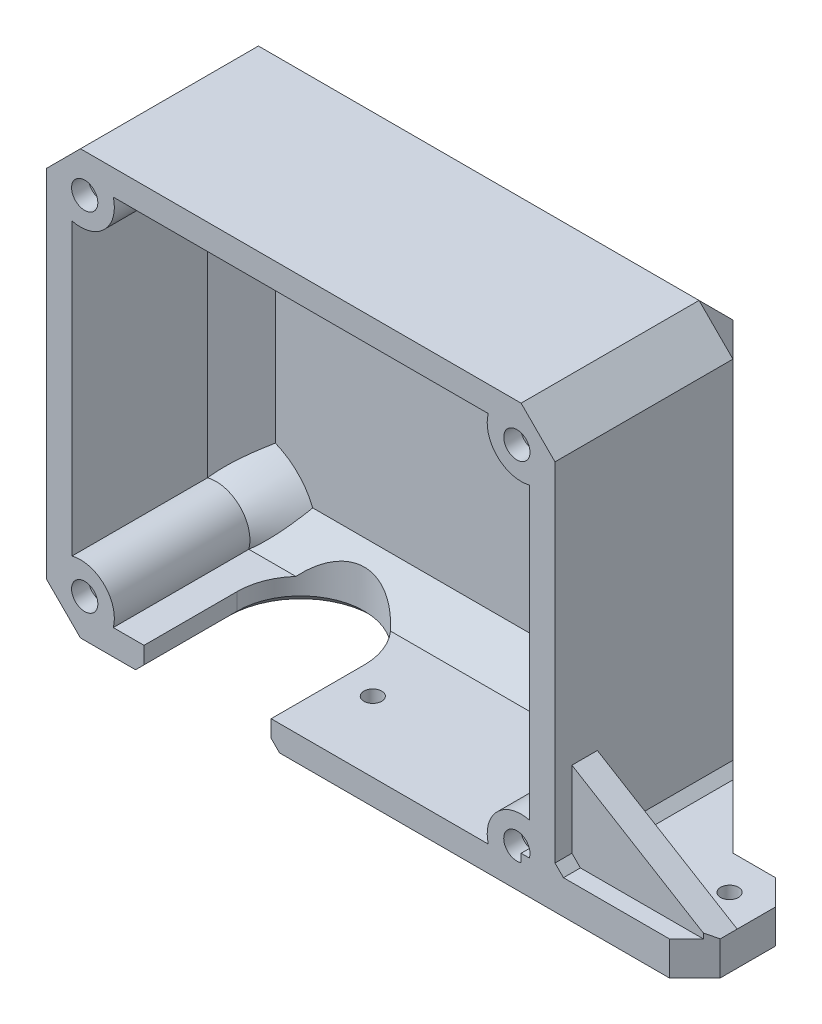
from build123d import *

# Parameters (mm, degrees)
BOSS_EXTRUDE1_DEPTH = 5
BOSS_EXTRUDE2_DEPTH = 20
CHAMFER1_SIZE       = 4
CHAMFER2_SIZE       = 4
CUT_EXTRUDE1_REACH  = 84.006
SKETCH3_R           = 7.5
SKETCH5_R           = 1.550000000000001
SKETCH5_R_2         = 1.5500000000000018
SKETCH5_R_3         = 1.5500000000000012
SKETCH5_R_4         = 1.5500000000000003
CUT_EXTRUDE2_DEPTH  = 2
CHAMFER3_SIZE       = 1
BOSS_EXTRUDE3_DEPTH = 4
CUT_EXTRUDE3_REACH  = 81.126
CUT_EXTRUDE5_REACH  = 96.748
SKETCH10_R          = 1.050000000000002
SKETCH10_R_2        = 1.0499999999999956
BOSS_EXTRUDE5_DEPTH = 3
CHAMFER6_SIZE       = 1
CHAMFER7_SIZE       = 3


with BuildPart() as part:
    # Sketch1 → Boss-Extrude1 (new body)
    with BuildSketch(Plane.XY):
        Polygon((0, 0), (3.28e-15, 50), (60, 50), (60, -1.4e-16), align=None)
    extrude(amount=BOSS_EXTRUDE1_DEPTH)

    # Sketch2 → Boss-Extrude2 (add)
    with BuildSketch(Plane.XY.offset(5)):
        with BuildLine():
            Line((7.872983346207448, 47), (52.127016653792545, 47))
            ThreePointArc((52.12701665379256, 46.99999999999996), (53.55051025721673, 49.16227766016832), (55.99999999999984, 50.00000000000001))
            Line((55.99999999999984, 50), (3.9999999999998224, 50))
            ThreePointArc((3.999999999999821, 50), (6.449489742783131, 49.16227766016842), (7.872983346207436, 46.99999999999996))
        make_face()
        with BuildLine():
            ThreePointArc((0, 46), (1.1715728752537458, 48.82842712474613), (3.999999999999821, 50))
            Line((3.9999999999998224, 50), (0, 50))
            Line((3.28e-15, 50), (3.02e-15, 46))
        make_face()
        with BuildLine():
            ThreePointArc((8.000000000000007, 46), (7.968118785068677, 46.50401716993089), (7.872983346207436, 46.99999999999996))
            Line((7.872983346207448, 47), (3.000000000000007, 47))
            Line((3.0000000000000036, 47), (3.000000000000003, 42.12701665379265))
            ThreePointArc((2.999999999999857, 42.127016653792616), (6.4494897427831255, 42.83772233983157), (8.000000000000007, 46))
        make_face()
        with BuildLine():
            Line((3.000000000000007, 47), (7.872983346207448, 47))
            ThreePointArc((7.872983346207436, 46.99999999999996), (6.449489742783131, 49.16227766016842), (3.999999999999821, 50))
            ThreePointArc((3.999999999999821, 50), (1.1715728752537458, 48.82842712474613), (0, 46))
            ThreePointArc((0, 46), (0.8377223398315752, 43.55051025721688), (2.999999999999857, 42.127016653792616))
            Line((3.000000000000003, 42.12701665379265), (3.0000000000000036, 47))
        make_face()
        with BuildLine():
            ThreePointArc((-1.78e-15, 3.9999999936735127), (0.8377223378945806, 6.449489740282477), (3.0000000000001434, 7.8729833462074605))
            Line((3.000000000000001, 7.872983346207491), (3.000000000000003, 42.12701665379265))
            ThreePointArc((2.999999999999857, 42.127016653792616), (0.8377223398315752, 43.55051025721688), (0, 46))
            Line((3.02e-15, 46), (2.6e-16, 3.999999993673512))
        make_face()
        with BuildLine():
            ThreePointArc((8.000000000000007, 46), (7.968118785068677, 46.50401716993089), (7.872983346207436, 46.99999999999996))
            Line((7.872983346207448, 47), (3.000000000000007, 47))
            Line((3.0000000000000036, 47), (3.000000000000003, 42.12701665379265))
            ThreePointArc((2.999999999999857, 42.127016653792616), (6.4494897427831255, 42.83772233983157), (8.000000000000007, 46))
        make_face()
        with BuildLine():
            Line((3.000000000000007, 47), (7.872983346207448, 47))
            ThreePointArc((7.872983346207436, 46.99999999999996), (6.449489742783131, 49.16227766016842), (3.999999999999821, 50))
            ThreePointArc((3.999999999999821, 50), (1.1715728752537458, 48.82842712474613), (0, 46))
            ThreePointArc((0, 46), (0.8377223398315752, 43.55051025721688), (2.999999999999857, 42.127016653792616))
            Line((3.000000000000003, 42.12701665379265), (3.0000000000000036, 47))
        make_face()
        with BuildLine():
            ThreePointArc((3.999999999999755, 8.9e-16), (6.449489742783102, 0.8377223398315614), (7.872983346207432, 3.0000000000000497))
            Line((7.8729833462074446, 3), (3.0000000000000004, 3))
            Line((3.0000000000000004, 3), (3.000000000000001, 7.872983346207491))
            ThreePointArc((3.0000000000001434, 7.8729833462074605), (0.8377223378945806, 6.449489740282477), (-1.78e-15, 3.9999999936735127))
            ThreePointArc((-1.78e-15, 3.9999999936735127), (1.1715728774904743, 1.1715728730171464), (3.999999999999755, 8.9e-16))
        make_face()
        with BuildLine():
            Line((3.0000000000000004, 3), (7.8729833462074446, 3))
            ThreePointArc((7.872983346207432, 3.0000000000000497), (7.968118785068674, 3.4959828300691127), (8.000000000000004, 4.000000000000003))
            ThreePointArc((8.000000000000004, 4.0000000000000036), (6.449489742783239, 7.16227766016834), (3.0000000000001434, 7.8729833462074605))
            Line((3.000000000000001, 7.872983346207491), (3.0000000000000004, 3))
        make_face()
        with BuildLine():
            Line((0, 0), (3.999999999999755, -1e-17))
            ThreePointArc((3.999999999999755, 8.9e-16), (1.1715728774904743, 1.1715728730171464), (-1.78e-15, 3.9999999936735127))
            Line((2.6e-16, 3.999999993673512), (0, 0))
        make_face()
        with BuildLine():
            ThreePointArc((55.99999999999975, -1.066e-14), (53.55051025721669, 0.8377223398317017), (52.12701665379255, 3.0000000000000497))
            Line((52.12701665379255, 3), (7.8729833462074446, 3))
            ThreePointArc((7.872983346207432, 3.0000000000000497), (6.449489742783102, 0.8377223398315614), (3.999999999999755, 8.9e-16))
            Line((3.999999999999755, -1e-17), (55.99999999999976, -1.3e-16))
        make_face()
        with BuildLine():
            ThreePointArc((3.999999999999755, 8.9e-16), (6.449489742783102, 0.8377223398315614), (7.872983346207432, 3.0000000000000497))
            Line((7.8729833462074446, 3), (3.0000000000000004, 3))
            Line((3.0000000000000004, 3), (3.000000000000001, 7.872983346207491))
            ThreePointArc((3.0000000000001434, 7.8729833462074605), (0.8377223378945806, 6.449489740282477), (-1.78e-15, 3.9999999936735127))
            ThreePointArc((-1.78e-15, 3.9999999936735127), (1.1715728774904743, 1.1715728730171464), (3.999999999999755, 8.9e-16))
        make_face()
        with BuildLine():
            Line((3.0000000000000004, 3), (7.8729833462074446, 3))
            ThreePointArc((7.872983346207432, 3.0000000000000497), (7.968118785068674, 3.4959828300691127), (8.000000000000004, 4.000000000000003))
            ThreePointArc((8.000000000000004, 4.0000000000000036), (6.449489742783239, 7.16227766016834), (3.0000000000001434, 7.8729833462074605))
            Line((3.000000000000001, 7.872983346207491), (3.0000000000000004, 3))
        make_face()
        with BuildLine():
            Line((52.127016653792545, 3), (56.99999999999999, 3))
            Line((56.99999999999999, 3), (56.99999999999999, 7.872983346207451))
            ThreePointArc((56.99999999999993, 7.872983346207436), (53.171572875253794, 6.828427124746189), (52.12701665379255, 3.0000000000000497))
        make_face()
        with BuildLine():
            Line((56.99999999999999, 7.872983346207451), (56.99999999999999, 3))
            Line((56.99999999999999, 3), (52.127016653792545, 3))
            ThreePointArc((52.12701665379255, 3.0000000000000497), (53.55051025721669, 0.8377223398317017), (55.99999999999975, -1.066e-14))
            ThreePointArc((55.99999999999975, -1.066e-14), (58.8284271247461, 1.1715728752537156), (60, 3.9999999999999956))
            ThreePointArc((60, 3.9999999999999964), (59.16227766016836, 6.4494897427832045), (56.99999999999993, 7.872983346207436))
        make_face()
        with BuildLine():
            Line((60, -1.4e-16), (60, 3.9999999999999964))
            ThreePointArc((60, 3.9999999999999956), (58.8284271247461, 1.1715728752537156), (55.99999999999975, -1.066e-14))
            Line((55.99999999999975, -1.3e-16), (60, -1.4e-16))
        make_face()
        with BuildLine():
            Line((52.127016653792545, 3), (56.99999999999999, 3))
            Line((56.99999999999999, 3), (56.99999999999999, 7.872983346207451))
            ThreePointArc((56.99999999999993, 7.872983346207436), (53.171572875253794, 6.828427124746189), (52.12701665379255, 3.0000000000000497))
        make_face()
        with BuildLine():
            Line((56.99999999999999, 7.872983346207451), (56.99999999999999, 3))
            Line((56.99999999999999, 3), (52.127016653792545, 3))
            ThreePointArc((52.12701665379255, 3.0000000000000497), (53.55051025721669, 0.8377223398317017), (55.99999999999975, -1.066e-14))
            ThreePointArc((55.99999999999975, -1.066e-14), (58.8284271247461, 1.1715728752537156), (60, 3.9999999999999956))
            ThreePointArc((60, 3.9999999999999964), (59.16227766016836, 6.4494897427832045), (56.99999999999993, 7.872983346207436))
        make_face()
        with BuildLine():
            Line((56.99999999999999, 42.127016653792545), (56.99999999999999, 7.872983346207451))
            ThreePointArc((56.99999999999993, 7.872983346207436), (59.16227766016836, 6.4494897427832045), (60, 3.9999999999999964))
            Line((60, 3.9999999999999964), (60, 46))
            ThreePointArc((60, 46), (59.16227766016836, 43.55051025721679), (56.99999999999993, 42.12701665379256))
        make_face()
        with BuildLine():
            ThreePointArc((55.99999999999984, 50.00000000000001), (58.828427124746135, 48.82842712474625), (60, 46))
            Line((60, 46), (60, 50))
            Line((60, 50), (55.99999999999984, 50))
        make_face()
        with BuildLine():
            ThreePointArc((52.12701665379256, 46.99999999999996), (53.171572875253794, 43.171572875253815), (56.99999999999993, 42.12701665379256))
            Line((56.99999999999999, 42.127016653792545), (56.99999999999999, 47))
            Line((56.99999999999999, 47), (52.127016653792545, 47))
        make_face()
        with BuildLine():
            Line((56.99999999999999, 47), (56.99999999999999, 42.127016653792545))
            ThreePointArc((56.99999999999993, 42.12701665379256), (59.16227766016836, 43.55051025721679), (60, 46))
            ThreePointArc((60, 46), (58.828427124746135, 48.82842712474625), (55.99999999999984, 50.00000000000001))
            ThreePointArc((55.99999999999984, 50.00000000000001), (53.55051025721673, 49.16227766016832), (52.12701665379256, 46.99999999999996))
            Line((52.127016653792545, 47), (56.99999999999999, 47))
        make_face()
        with BuildLine():
            ThreePointArc((52.12701665379256, 46.99999999999996), (53.171572875253794, 43.171572875253815), (56.99999999999993, 42.12701665379256))
            Line((56.99999999999999, 42.127016653792545), (56.99999999999999, 47))
            Line((56.99999999999999, 47), (52.127016653792545, 47))
        make_face()
        with BuildLine():
            Line((56.99999999999999, 47), (56.99999999999999, 42.127016653792545))
            ThreePointArc((56.99999999999993, 42.12701665379256), (59.16227766016836, 43.55051025721679), (60, 46))
            ThreePointArc((60, 46), (58.828427124746135, 48.82842712474625), (55.99999999999984, 50.00000000000001))
            ThreePointArc((55.99999999999984, 50.00000000000001), (53.55051025721673, 49.16227766016832), (52.12701665379256, 46.99999999999996))
            Line((52.127016653792545, 47), (56.99999999999999, 47))
        make_face()
    extrude(amount=BOSS_EXTRUDE2_DEPTH)

    # Chamfer1
    chamfer1_edges = [part.edges().sort_by_distance(p)[0] for p in [
        (6.828427124746156, 43.171572875253766, 5),
        (53.171572875253794, 43.171572875253815, 5),
        (53.171572875253794, 6.828427124746188, 5),
        (56.99999999999999, 24.999999999999996, 5),
        (29.999999999999996, 47, 5),
        (2.999999999999961, 25.000000000000057, 5),
        (6.828427124746214, 6.828427124746155, 5),
        (30, 3, 5),
    ]]
    chamfer(chamfer1_edges, length=CHAMFER1_SIZE)

    # Chamfer2
    chamfer2_edges = [part.edges().sort_by_distance(p)[0] for p in [
        (1.64e-15, 25, 0),
        (30.000000000000004, 50, 0),
        (60, 25, 0),
        (30, -7e-17, 0),
        (0, 0, 12.5),
        (2.46e-15, 50, 12.5),
        (60, 50, 12.5),
        (60, -1.4e-16, 12.5),
    ]]
    chamfer(chamfer2_edges, length=CHAMFER2_SIZE)

    # Sketch3 → Cut-Extrude1 (cut, up to next)
    with BuildSketch(Plane.XZ, mode=Mode.PRIVATE) as cut_extrude1_sk1:
        with BuildLine():
            Line((11.499999999999982, 25), (11.499999999999982, 14.000000000000004))
            ThreePointArc((11.499999999999982, 14.000000000000007), (18.999999999999986, 21.500000000000004), (26.499999999999982, 14.000000000000004))
            Line((26.499999999999982, 14.000000000000004), (26.499999999999982, 25))
            Line((26.499999999999982, 25), (11.499999999999982, 25))
        make_face()
    cut_extrude1_tool1 = extrude(cut_extrude1_sk1.sketch, amount=-CUT_EXTRUDE1_REACH, mode=Mode.PRIVATE) & part.part
    # Sketch3 → Cut-Extrude1 (cut, up to next)
    with BuildSketch(Plane.XZ, mode=Mode.PRIVATE) as cut_extrude1_sk2:
        with Locations((18.999999999999982, 14.000000000000004)):
            Circle(SKETCH3_R)
    cut_extrude1_tool2 = extrude(cut_extrude1_sk2.sketch, amount=-CUT_EXTRUDE1_REACH, mode=Mode.PRIVATE) & part.part
    add(cut_extrude1_tool1.solids().sort_by_distance((19, 0, 22.171032))[0], mode=Mode.SUBTRACT)
    add(cut_extrude1_tool2.solids().sort_by_distance((19, 0, 14))[0], mode=Mode.SUBTRACT)

    # Sketch5 → Cut-Extrude2 (cut)
    with BuildSketch(Plane.XY.offset(25)):
        with Locations((4.5, 45.50000000000001)):
            Circle(SKETCH5_R)
        with Locations((55.5, 45.50000000000001)):
            Circle(SKETCH5_R_2)
        with Locations(Location((55.5, 4.49999999999999, 0), (0, 0, 180))):
            Circle(SKETCH5_R_3)
        with Locations(Location((4.499999999999998, 4.499999999999997, 0), (0, 0, 180))):
            Circle(SKETCH5_R_4)
    extrude(amount=-CUT_EXTRUDE2_DEPTH, mode=Mode.SUBTRACT)

    # Chamfer3
    chamfer3_edges = [part.edges().sort_by_distance(p)[0] for p in [
        (18.999999999999982, -4e-17, 6.5000000000000036),
        (26.499999999999982, -6e-17, 19.5),
        (11.499999999999982, -3e-17, 19.5),
    ]]
    chamfer(chamfer3_edges, length=CHAMFER3_SIZE)

    # Sketch6 → Boss-Extrude3 (add)
    with BuildSketch(Plane.XZ):
        Polygon((76.49999999999997, 25), (56.00000000000001, 25), (55.99999999999999, 0), (68.4852813742386, 12.48528137423854), (76.49999999999997, 12.48528137423853), align=None)
    extrude(amount=-BOSS_EXTRUDE3_DEPTH)

    # Sketch7 → Cut-Extrude3 (cut, up to next)
    with BuildSketch(Plane.ZY.offset(-56.000000000000014), mode=Mode.PRIVATE) as cut_extrude3_sk1:
        Polygon((3.9999999999999827, 6e-17), (0, 4.0000000000000036), (6.94e-15, 0), align=None)
    cut_extrude3_tool1 = extrude(cut_extrude3_sk1.sketch, amount=-CUT_EXTRUDE3_REACH, mode=Mode.PRIVATE) & part.part
    add(cut_extrude3_tool1.solids().sort_by_distance((56, 1.333333, 1.333333))[0], mode=Mode.SUBTRACT)

    # Sketch10 → Cut-Extrude5 (cut, up to next)
    with BuildSketch(Plane.XZ, mode=Mode.PRIVATE) as cut_extrude5_sk1:
        with Locations((72.29999999999998, 16.70000000000001)):
            Circle(SKETCH10_R)
    cut_extrude5_tool1 = extrude(cut_extrude5_sk1.sketch, amount=-CUT_EXTRUDE5_REACH, mode=Mode.PRIVATE) & part.part
    # Sketch10 → Cut-Extrude5 (cut, up to next)
    with BuildSketch(Plane.XZ, mode=Mode.PRIVATE) as cut_extrude5_sk2:
        with Locations((30.199999999999992, 16.700000000000024)):
            Circle(SKETCH10_R_2)
    cut_extrude5_tool2 = extrude(cut_extrude5_sk2.sketch, amount=-CUT_EXTRUDE5_REACH, mode=Mode.PRIVATE) & part.part
    add(cut_extrude5_tool1.solids().sort_by_distance((72.3, 0, 16.7))[0], mode=Mode.SUBTRACT)
    add(cut_extrude5_tool2.solids().sort_by_distance((30.2, 0, 16.7))[0], mode=Mode.SUBTRACT)

    # Sketch11 → Boss-Extrude5 (add)
    with BuildSketch(Plane.XY.offset(23)):
        Polygon((76.49999999999997, 3), (76.49999999999997, 4), (59.99999999999999, 4), (59.99999999999999, 14), (58.99999999999999, 14), (58.99999999999999, 3), align=None)
        Polygon((59.99999999999999, 4), (76.49999999999997, 4), (59.99999999999999, 14), align=None)
    extrude(amount=-BOSS_EXTRUDE5_DEPTH)

    # Chamfer6
    chamfer6_edges = [part.edges().sort_by_distance(p)[0] for p in [
        (60, 4, 12),
        (60, 4, 24),
    ]]
    chamfer(chamfer6_edges, length=CHAMFER6_SIZE)

    # Chamfer7
    # the kernel refuses this chamfer: 3 mm, written as the material it takes off along each edge
    with BuildSketch(Plane(origin=(76.49999999999997, -7.715048963897736, 25), x_dir=(-0.9996219169112965, 0, 0.02749587661058676), z_dir=(0, 1, 0))) as chamfer7_piece_1:
        Polygon((CHAMFER7_SIZE * 0.999621916911, -CHAMFER7_SIZE * 0.0274958766106), (-CHAMFER7_SIZE * 0.0274958766106, -CHAMFER7_SIZE * 0.999621916911), (0, 0), align=None)
    extrude(amount=19.430097927795472, mode=Mode.SUBTRACT)
    with BuildSketch(Plane(origin=(76.49999999999997, -7.715048963897734, 12.48528137423853), x_dir=(0.02749587661058678, 0, 0.9996219169112968), z_dir=(0, 1, 0))) as chamfer7_piece_2:
        Polygon((CHAMFER7_SIZE * 0.999621916911, -CHAMFER7_SIZE * 0.0274958766106), (-CHAMFER7_SIZE * 0.0274958766106, -CHAMFER7_SIZE * 0.999621916911), (0, 0), align=None)
    extrude(amount=19.43009792779547, mode=Mode.SUBTRACT)


solid = part.part
